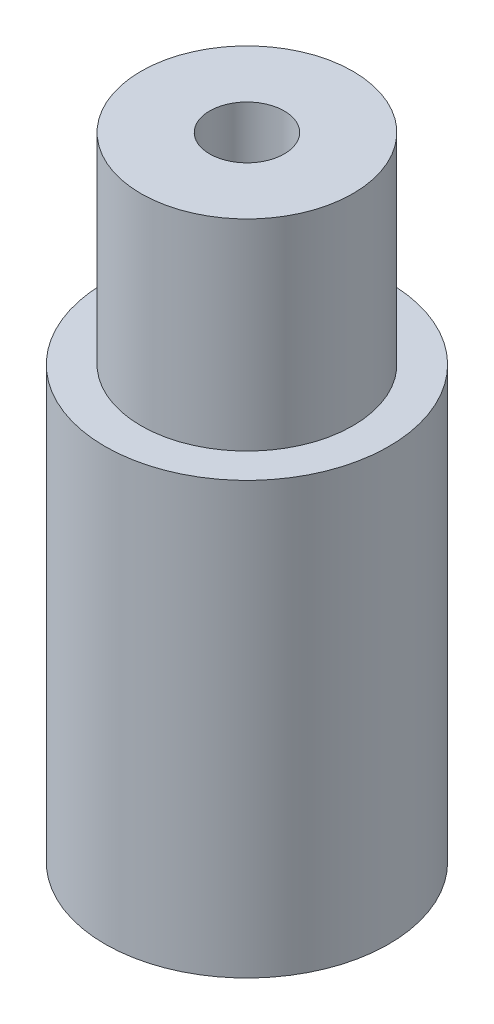
from build123d import *

# Parameters (mm, degrees)
SKETCH1_R            = 12.7
BOSS_EXTRUDE1_DEPTH  = 38.4175
SKETCH4_R            = 9.525
BOSS_EXTRUDE2_DEPTH  = 17.78
CUT_EXTRUDE1_DEPTH   = 11.176
SKETCH3_R            = 6
CUT_EXTRUDE2_DEPTH   = 8
SKETCH6_R            = 3.1496
CUT_EXTRUDE3_DEPTH   = 6.35
SPLIT1_START         = 11.325999954
SPLIT1_OUTLINE_R     = 12.550000046
SPLIT1_OUTLINE_R_2   = 6.149999954
SPLIT1_DEPTH         = 26.941500092
SPLIT1_START_2       = 19.325999954
SPLIT1_2_OUTLINE_R   = 9.375000046
SPLIT1_2_OUTLINE_R_2 = 3.299599954
SPLIT1_2_DEPTH       = 36.721500092
SPLIT1_START_3       = 0.149999954
SPLIT1_3_OUTLINE_R   = 12.550000046
SPLIT1_3_DEPTH       = 11.176
SPLIT1_4_OUTLINE_R   = 3.299599954
SPLIT1_4_DEPTH       = 30.371500092
SPLIT1_5_OUTLINE_R   = 12.550000046
SPLIT1_5_OUTLINE_R_2 = 6.149999954
SPLIT1_5_DEPTH       = 26.941500092
SPLIT1_6_OUTLINE_R   = 9.375000046
SPLIT1_6_OUTLINE_R_2 = 3.299599954
SPLIT1_6_DEPTH       = 36.721500092
SPLIT1_7_OUTLINE_R   = 12.550000046
SPLIT1_7_DEPTH       = 11.176
SPLIT1_8_OUTLINE_R   = 3.299599954
SPLIT1_8_DEPTH       = 30.371500092


with BuildPart() as part:
    # Sketch1 → Boss-Extrude1 (new body)
    with BuildSketch(Plane(origin=(0, 0, 0), x_dir=(1, 0, 0), z_dir=(0, 1, 0))):
        with Locations(Location((0, 0, 0), (0, 0, 270))):
            Circle(SKETCH1_R)
    extrude(amount=BOSS_EXTRUDE1_DEPTH)

    # Sketch4 → Boss-Extrude2 (add)
    with BuildSketch(Plane(origin=(0, 38.4175, 0), x_dir=(1, 0, 0), z_dir=(0, 1, 0))):
        with Locations(Location((0, 0, 0), (0, 0, 270))):
            Circle(SKETCH4_R)
    extrude(amount=BOSS_EXTRUDE2_DEPTH)

    # Sketch2 → Cut-Extrude1 (cut)
    with BuildSketch(Plane.XZ):
        with BuildLine():
            Line((-7, 2.899494937), (-8.776962921, 1.122532015))
            ThreePointArc((-8.776962921, 1.122532015), (-9.241930906, 0), (-8.776962921, -1.122532015))
            Line((-8.776962921, -1.122532015), (-7, -2.899494937))
            Line((-7, -2.899494937), (-7, 2.899494937))
        make_face()
        Polygon((-2.899494937, 7), (-7, 2.899494937), (-7, -2.899494937), (-2.899494937, -7), (2.899494937, -7), (7, -2.899494937), (7, 2.899494937), (2.899494937, 7), align=None)
        with BuildLine():
            Line((-7, 5.4125), (-7, 2.899494937))
            Line((-7, 2.899494937), (-2.899494937, 7))
            Line((-2.899494937, 7), (-5.4125, 7))
            ThreePointArc((-5.4125, 7), (-6.535032015, 6.535032015), (-7, 5.4125))
        make_face()
        with BuildLine():
            Line((-1.122532015, 8.776962921), (-2.899494937, 7))
            Line((-2.899494937, 7), (2.899494937, 7))
            Line((2.899494937, 7), (1.122532015, 8.776962921))
            ThreePointArc((1.122532015, 8.776962921), (0, 9.241930906), (-1.122532015, 8.776962921))
        make_face()
        with BuildLine():
            Line((5.4125, 7), (2.899494937, 7))
            Line((2.899494937, 7), (7, 2.899494937))
            Line((7, 2.899494937), (7, 5.4125))
            ThreePointArc((7, 5.4125), (6.535032015, 6.535032015), (5.4125, 7))
        make_face()
        with BuildLine():
            Line((8.776962921, 1.122532015), (7, 2.899494937))
            Line((7, 2.899494937), (7, -2.899494937))
            Line((7, -2.899494937), (8.776962921, -1.122532015))
            ThreePointArc((8.776962921, -1.122532015), (9.241930906, 0), (8.776962921, 1.122532015))
        make_face()
        with BuildLine():
            Line((7, -2.899494937), (2.899494937, -7))
            Line((2.899494937, -7), (5.4125, -7))
            ThreePointArc((5.4125, -7), (6.535032015, -6.535032015), (7, -5.4125))
            Line((7, -5.4125), (7, -2.899494937))
        make_face()
        with BuildLine():
            Line((2.899494937, -7), (-2.899494937, -7))
            Line((-2.899494937, -7), (-1.122532015, -8.776962921))
            ThreePointArc((-1.122532015, -8.776962921), (0, -9.241930906), (1.122532015, -8.776962921))
            Line((1.122532015, -8.776962921), (2.899494937, -7))
        make_face()
        with BuildLine():
            Line((-2.899494937, -7), (-7, -2.899494937))
            Line((-7, -2.899494937), (-7, -5.4125))
            ThreePointArc((-7, -5.4125), (-6.535032015, -6.535032015), (-5.4125, -7))
            Line((-5.4125, -7), (-2.899494937, -7))
        make_face()
    extrude(amount=-CUT_EXTRUDE1_DEPTH, mode=Mode.SUBTRACT)

    # Sketch3 → Cut-Extrude2 (cut)
    with BuildSketch(Plane.XZ.offset(-11.176)):
        with Locations(Location((0, 0, 0), (0, 0, 270))):
            Circle(SKETCH3_R)
    extrude(amount=-CUT_EXTRUDE2_DEPTH, mode=Mode.SUBTRACT)

    # Sketch6 → Cut-Extrude3 (cut)
    with BuildSketch(Plane(origin=(0, 56.1975, 0), x_dir=(1, 0, 0), z_dir=(0, 1, 0))):
        with Locations(Location((0, 0, 0), (0, 0, 270))):
            Circle(SKETCH6_R)
    extrude(amount=-CUT_EXTRUDE3_DEPTH, mode=Mode.SUBTRACT)

    # Split1 5 outline → Split1 5 (cut)
    with BuildSketch(Plane(origin=(0, 0, 0), x_dir=(1, 0, 0), z_dir=(0, 1, 0)).offset(SPLIT1_START)):
        Circle(SPLIT1_5_OUTLINE_R)
        Circle(SPLIT1_5_OUTLINE_R_2, mode=Mode.SUBTRACT)
    extrude(amount=SPLIT1_5_DEPTH, mode=Mode.SUBTRACT)

    # Split1 6 outline → Split1 6 (cut)
    with BuildSketch(Plane(origin=(0, 0, 0), x_dir=(1, 0, 0), z_dir=(0, 1, 0)).offset(SPLIT1_START_2)):
        Circle(SPLIT1_6_OUTLINE_R)
        Circle(SPLIT1_6_OUTLINE_R_2, mode=Mode.SUBTRACT)
    extrude(amount=SPLIT1_6_DEPTH, mode=Mode.SUBTRACT)

    # Split1 7 outline → Split1 7 (cut)
    with BuildSketch(Plane(origin=(0, 0, 0), x_dir=(1, 0, 0), z_dir=(0, 1, 0)).offset(SPLIT1_START_3)):
        Circle(SPLIT1_7_OUTLINE_R)
        with BuildLine():
            Line((-7.149999954, -2.961626952), (-8.883028906, -1.228598))
            ThreePointArc((-8.883028906, -1.228598), (-9.39193086, 0), (-8.883028906, 1.228598))
            Line((-8.883028906, 1.228598), (-7.149999954, 2.961626952))
            Line((-7.149999954, 2.961626952), (-7.149999954, 5.4125))
            ThreePointArc((-7.149999954, 5.4125), (-6.641098, 6.641098), (-5.4125, 7.149999954))
            Line((-5.4125, 7.149999954), (-2.961626952, 7.149999954))
            Line((-2.961626952, 7.149999954), (-1.228598, 8.883028906))
            ThreePointArc((-1.228598, 8.883028906), (0, 9.39193086), (1.228598, 8.883028906))
            Line((1.228598, 8.883028906), (2.961626952, 7.149999954))
            Line((2.961626952, 7.149999954), (5.4125, 7.149999954))
            ThreePointArc((5.4125, 7.149999954), (6.641098, 6.641098), (7.149999954, 5.4125))
            Line((7.149999954, 5.4125), (7.149999954, 2.961626952))
            Line((7.149999954, 2.961626952), (8.883028906, 1.228598))
            ThreePointArc((8.883028906, 1.228598), (9.39193086, 0), (8.883028906, -1.228598))
            Line((8.883028906, -1.228598), (7.149999954, -2.961626952))
            Line((7.149999954, -2.961626952), (7.149999954, -5.4125))
            ThreePointArc((7.149999954, -5.4125), (6.641098, -6.641098), (5.4125, -7.149999954))
            Line((5.4125, -7.149999954), (2.961626952, -7.149999954))
            Line((2.961626952, -7.149999954), (1.228598, -8.883028906))
            ThreePointArc((1.228598, -8.883028906), (0, -9.39193086), (-1.228598, -8.883028906))
            Line((-1.228598, -8.883028906), (-2.961626952, -7.149999954))
            Line((-2.961626952, -7.149999954), (-5.4125, -7.149999954))
            ThreePointArc((-5.4125, -7.149999954), (-6.641098, -6.641098), (-7.149999954, -5.4125))
            Line((-7.149999954, -5.4125), (-7.149999954, -2.961626952))
        make_face(mode=Mode.SUBTRACT)
    extrude(amount=SPLIT1_7_DEPTH, mode=Mode.SUBTRACT)

    # Split1 8 outline → Split1 8 (cut)
    with BuildSketch(Plane(origin=(0, 0, 0), x_dir=(1, 0, 0), z_dir=(0, 1, 0)).offset(SPLIT1_START_2)):
        Circle(SPLIT1_8_OUTLINE_R)
    extrude(amount=SPLIT1_8_DEPTH, mode=Mode.SUBTRACT)


with BuildPart() as body_2:
    # Split1: read off the stored shape, not the designer's step
    # Split1 outline → Split1 (new body)
    with BuildSketch(Plane(origin=(0, 0, 0), x_dir=(1, 0, 0), z_dir=(0, 1, 0)).offset(SPLIT1_START)):
        Circle(SPLIT1_OUTLINE_R)
        Circle(SPLIT1_OUTLINE_R_2, mode=Mode.SUBTRACT)
    extrude(amount=SPLIT1_DEPTH)

    # Split1 2 outline → Split1 2 (add)
    with BuildSketch(Plane(origin=(0, 0, 0), x_dir=(1, 0, 0), z_dir=(0, 1, 0)).offset(SPLIT1_START_2)):
        Circle(SPLIT1_2_OUTLINE_R)
        Circle(SPLIT1_2_OUTLINE_R_2, mode=Mode.SUBTRACT)
    extrude(amount=SPLIT1_2_DEPTH)

    # Split1 3 outline → Split1 3 (add)
    with BuildSketch(Plane(origin=(0, 0, 0), x_dir=(1, 0, 0), z_dir=(0, 1, 0)).offset(SPLIT1_START_3)):
        Circle(SPLIT1_3_OUTLINE_R)
        with BuildLine():
            Line((7.149999954, 5.4125), (7.149999954, 2.961626952))
            Line((7.149999954, 2.961626952), (8.883028906, 1.228598))
            ThreePointArc((8.883028906, 1.228598), (9.39193086, 0), (8.883028906, -1.228598))
            Line((8.883028906, -1.228598), (7.149999954, -2.961626952))
            Line((7.149999954, -2.961626952), (7.149999954, -5.4125))
            ThreePointArc((7.149999954, -5.4125), (6.641098, -6.641098), (5.4125, -7.149999954))
            Line((5.4125, -7.149999954), (2.961626952, -7.149999954))
            Line((2.961626952, -7.149999954), (1.228598, -8.883028906))
            ThreePointArc((1.228598, -8.883028906), (0, -9.39193086), (-1.228598, -8.883028906))
            Line((-1.228598, -8.883028906), (-2.961626952, -7.149999954))
            Line((-2.961626952, -7.149999954), (-5.4125, -7.149999954))
            ThreePointArc((-5.4125, -7.149999954), (-6.641098, -6.641098), (-7.149999954, -5.4125))
            Line((-7.149999954, -5.4125), (-7.149999954, -2.961626952))
            Line((-7.149999954, -2.961626952), (-8.883028906, -1.228598))
            ThreePointArc((-8.883028906, -1.228598), (-9.39193086, 0), (-8.883028906, 1.228598))
            Line((-8.883028906, 1.228598), (-7.149999954, 2.961626952))
            Line((-7.149999954, 2.961626952), (-7.149999954, 5.4125))
            ThreePointArc((-7.149999954, 5.4125), (-6.641098, 6.641098), (-5.4125, 7.149999954))
            Line((-5.4125, 7.149999954), (-2.961626952, 7.149999954))
            Line((-2.961626952, 7.149999954), (-1.228598, 8.883028906))
            ThreePointArc((-1.228598, 8.883028906), (0, 9.39193086), (1.228598, 8.883028906))
            Line((1.228598, 8.883028906), (2.961626952, 7.149999954))
            Line((2.961626952, 7.149999954), (5.4125, 7.149999954))
            ThreePointArc((5.4125, 7.149999954), (6.641098, 6.641098), (7.149999954, 5.4125))
        make_face(mode=Mode.SUBTRACT)
    extrude(amount=SPLIT1_3_DEPTH)

    # Split1 4 outline → Split1 4 (add)
    with BuildSketch(Plane(origin=(0, 0, 0), x_dir=(1, 0, 0), z_dir=(0, 1, 0)).offset(SPLIT1_START_2)):
        Circle(SPLIT1_4_OUTLINE_R)
    extrude(amount=SPLIT1_4_DEPTH)


solid = body_2.part
